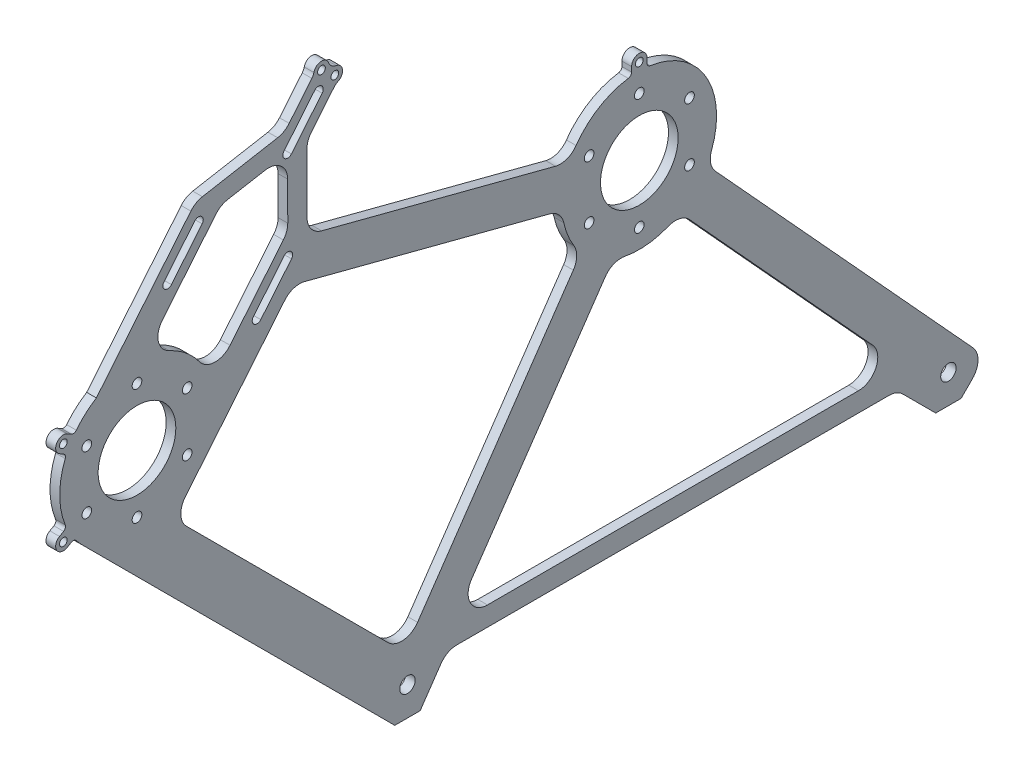
from build123d import *

# Parameters (mm, degrees)
SZKIC1_R                    = 2.5
SZKIC1_R_2                  = 4
SZKIC1_R_3                  = 2
SZKIC1_R_4                  = 20.1
DODANIE_WYCI_GNI_CIE1_DEPTH = 5


with BuildPart() as part:
    # Szkic1 → Dodanie-wyciągnięcie1 (new body)
    with BuildSketch(Plane(origin=(0, 0, 0), x_dir=(0, 0, -1), z_dir=(1, 0, 0))):
        with BuildLine():
            Line((-288.284271247, -28.284271247), (-126.568542495, -190))
            Line((-126.568542495, -190), (-113.431457505, -190))
            Line((-113.431457505, -190), (-102.696405924, -174.344716444))
            ThreePointArc((-102.696405924, -174.344716444), (-99.109973789, -171.152603898), (-94.449117406, -170))
            Line((-94.449117406, -170), (129.289321881, -170))
            ThreePointArc((129.289321881, -170), (133.116156205, -170.761204675), (136.360389693, -172.928932188))
            Line((136.360389693, -172.928932188), (153.431457505, -190))
            Line((153.431457505, -190), (166.568542495, -190))
            Line((166.568542495, -190), (172.387546571, -184.180995923))
            ThreePointArc((172.387546571, -184.180995923), (175.313976082, -177.333640604), (172.69676688, -170.362236116))
            Line((172.69676688, -170.362236116), (39.354768311, -24.519425181))
            ThreePointArc((39.354768311, -24.519425181), (36.912448001, -19.646930148), (37.388045144, -14.217386549))
            ThreePointArc((37.388045144, -14.217386549), (34.471063996, 20.29151909), (5.714285714, 39.589732744))
            ThreePointArc((5.714285714, 39.589732744), (4.488142108, 40.25991204), (4, 41.569219382))
            Line((4, 41.569219382), (4, 44))
            ThreePointArc((4, 44), (0, 48), (-4, 44))
            Line((-4, 44), (-4, 41.569219382))
            ThreePointArc((-4, 41.569219382), (-4.488142108, 40.25991204), (-5.714285714, 39.589732744))
            ThreePointArc((-5.714285714, 39.589732744), (-20.933019357, 34.085315029), (-32.725168605, 23.001376911))
            ThreePointArc((-32.725168605, 23.001376911), (-37.463043952, 19.36327714), (-43.429641732, 19.075277692))
            Line((-43.429641732, 19.075277692), (-164.484501116, 50.640937114))
            ThreePointArc((-164.484501116, 50.640937114), (-169.870082497, 54.197619293), (-171.961310445, 60.303455894))
            Line((-171.961310445, 60.303455894), (-172.004365765, 91.223607004))
            ThreePointArc((-172.004365765, 91.223607004), (-171.417448461, 94.613040026), (-169.716707821, 97.603058322))
            Line((-169.716707821, 97.603058322), (-157.907804878, 111.91046591))
            ThreePointArc((-157.907804878, 111.91046591), (-157.048974104, 112.729699644), (-156.021245372, 113.323423371))
            ThreePointArc((-156.021245372, 113.323423371), (-153.625331654, 117.475816061), (-156.934314069, 120.944735629))
            ThreePointArc((-156.934314069, 120.944735629), (-159.288806591, 122.019488985), (-160.790480249, 124.127498955))
            ThreePointArc((-160.790480249, 124.127498955), (-164.823865313, 126.718748175), (-168.446669732, 123.578994087))
            ThreePointArc((-168.446669732, 123.578994087), (-168.834765174, 122.457336324), (-169.47630342, 121.458755887))
            Line((-169.47630342, 121.458755887), (-181.241905694, 107.203810439))
            ThreePointArc((-181.241905694, 107.203810439), (-183.910862715, 104.93427107), (-187.198850713, 103.724611838))
            Line((-187.198850713, 103.724611838), (-226.153990373, 96.778622252))
            ThreePointArc((-226.153990373, 96.778622252), (-229.441978371, 95.568963021), (-232.110935392, 93.299423651))
            Line((-232.110935392, 93.299423651), (-281.037741396, 34.020779488))
            ThreePointArc((-281.037741396, 34.020779488), (-286.640103025, 29.83797766), (-291.428571429, 24.743582965))
            ThreePointArc((-291.428571429, 24.743582965), (-292.622035527, 24.016801101), (-294, 24.248711306))
            Line((-294, 24.248711306), (-296.105117767, 25.464101615))
            ThreePointArc((-296.105117767, 25.464101615), (-301.569219382, 24), (-300.105117767, 18.535898385))
            Line((-300.105117767, 18.535898385), (-298, 17.320508076))
            ThreePointArc((-298, 17.320508076), (-297.110177635, 16.243110939), (-297.142857143, 14.846149779))
            ThreePointArc((-297.142857143, 14.846149779), (-300, 0), (-297.142857143, -14.846149779))
            ThreePointArc((-297.142857143, -14.846149779), (-297.110177635, -16.243110939), (-298, -17.320508076))
            Line((-298, -17.320508076), (-300.105117767, -18.535898385))
            ThreePointArc((-300.105117767, -18.535898385), (-301.569219382, -24), (-296.105117767, -25.464101615))
            Line((-296.105117767, -25.464101615), (-294, -24.248711306))
            ThreePointArc((-294, -24.248711306), (-292.622035527, -24.016801101), (-291.428571429, -24.743582965))
            ThreePointArc((-291.428571429, -24.743582965), (-289.908861789, -26.560496729), (-288.284271247, -28.284271247))
        make_face()
        with Locations((-285.980762114, -15)):
            Circle(SZKIC1_R, mode=Mode.SUBTRACT)
        with Locations((-234.019237886, -15)):
            Circle(SZKIC1_R, mode=Mode.SUBTRACT)
        with Locations((-260, -30)):
            Circle(SZKIC1_R, mode=Mode.SUBTRACT)
        with Locations((-234.019237886, 15)):
            Circle(SZKIC1_R, mode=Mode.SUBTRACT)
        with Locations((-260, 30)):
            Circle(SZKIC1_R, mode=Mode.SUBTRACT)
        with Locations((-285.980762114, 15)):
            Circle(SZKIC1_R, mode=Mode.SUBTRACT)
        with Locations((-25.980762114, -15)):
            Circle(SZKIC1_R, mode=Mode.SUBTRACT)
        with Locations((0, 30)):
            Circle(SZKIC1_R, mode=Mode.SUBTRACT)
        with Locations((25.980762114, -15)):
            Circle(SZKIC1_R, mode=Mode.SUBTRACT)
        with Locations((-25.980762114, 15)):
            Circle(SZKIC1_R, mode=Mode.SUBTRACT)
        with Locations((0, -30)):
            Circle(SZKIC1_R, mode=Mode.SUBTRACT)
        with Locations((25.980762114, 15)):
            Circle(SZKIC1_R, mode=Mode.SUBTRACT)
        with Locations((160, -175)):
            Circle(SZKIC1_R_2, mode=Mode.SUBTRACT)
        with Locations((-120, -175)):
            Circle(SZKIC1_R_2, mode=Mode.SUBTRACT)
        with Locations((-157.596930712, 117)):
            Circle(SZKIC1_R_3, mode=Mode.SUBTRACT)
        with Locations((-298.105117767, 22)):
            Circle(SZKIC1_R_3, mode=Mode.SUBTRACT)
        with Locations((-298.105117767, -22)):
            Circle(SZKIC1_R_3, mode=Mode.SUBTRACT)
        with Locations((0, 44)):
            Circle(SZKIC1_R_3, mode=Mode.SUBTRACT)
        with Locations((-164.538029837, 122.728973986)):
            Circle(SZKIC1_R_3, mode=Mode.SUBTRACT)
        Circle(SZKIC1_R_4, mode=Mode.SUBTRACT)
        with Locations((-260, 0)):
            Circle(SZKIC1_R_4, mode=Mode.SUBTRACT)
        with BuildLine():
            Line((113.43104574, -160), (-78.606748373, -160))
            ThreePointArc((-78.606748373, -160), (-87.454144474, -154.660856383), (-86.854036891, -144.344716444))
            Line((-86.854036891, -144.344716444), (-17.668476451, -43.449107469))
            ThreePointArc((-17.668476451, -43.449107469), (-13.223838191, -39.855615376), (-7.536950346, -39.28351282))
            ThreePointArc((-7.536950346, -39.28351282), (3.864441422, -39.812888522), (14.951190435, -37.100699516))
            ThreePointArc((14.951190435, -37.100699516), (20.905737176, -36.624668147), (26.069276164, -39.628182399))
            Line((26.069276164, -39.628182399), (120.81133386, -143.252308005))
            ThreePointArc((120.81133386, -143.252308005), (122.581917828, -154.032559984), (113.43104574, -160))
        make_face(mode=Mode.SUBTRACT)
        with BuildLine():
            Line((-230.127631021, 87.847542068), (-246.041971216, 68.566076823))
            ThreePointArc((-246.041971216, 68.566076823), (-245.705269789, 65.04661207), (-242.185805036, 65.383313498))
            Line((-242.185805036, 65.383313498), (-226.271464841, 84.664778743))
            ThreePointArc((-226.271464841, 84.664778743), (-226.608166268, 88.184243496), (-230.127631021, 87.847542068))
        make_face(mode=Mode.SUBTRACT)
        with BuildLine():
            Line((-180.015328795, 45.851272047), (-195.92966899, 26.569806802))
            ThreePointArc((-195.92966899, 26.569806802), (-199.44913251, 26.233106867), (-199.78583517, 29.752570127))
            Line((-199.78583517, 29.752570127), (-183.871494975, 49.034035373))
            ThreePointArc((-183.871494975, 49.034035373), (-180.352030222, 49.3707368), (-180.015328795, 45.851272047))
        make_face(mode=Mode.SUBTRACT)
        with BuildLine():
            Line((-168.022669891, 115.365136739), (-183.937010086, 96.083671494))
            ThreePointArc((-183.937010086, 96.083671494), (-183.600307428, 92.564208231), (-180.080843905, 92.900908168))
            Line((-180.080843905, 92.900908168), (-164.16650371, 112.182373413))
            ThreePointArc((-164.16650371, 112.182373413), (-164.503205138, 115.701838166), (-168.022669891, 115.365136739))
        make_face(mode=Mode.SUBTRACT)
        with BuildLine():
            Line((-219.135917613, 85.455241508), (-246.893276278, 51.82503505))
            ThreePointArc((-246.893276278, 51.82503505), (-248.92741606, 43.222036437), (-243.344755134, 36.367606719))
            ThreePointArc((-243.344755134, 36.367606719), (-234.659585563, 30.949368267), (-227.634046499, 23.504149718))
            ThreePointArc((-227.634046499, 23.504149718), (-219.852138073, 19.384980283), (-211.830225762, 23.014660496))
            Line((-211.830225762, 23.014660496), (-184.252463803, 56.427271527))
            ThreePointArc((-184.252463803, 56.427271527), (-182.551723162, 59.417289823), (-181.964805859, 62.806722845))
            Line((-181.964805859, 62.806722845), (-181.992323332, 82.568379002))
            ThreePointArc((-181.992323332, 82.568379002), (-185.577134018, 90.225534472), (-193.747700979, 92.399179588))
            Line((-193.747700979, 92.399179588), (-213.178972594, 88.934440109))
            ThreePointArc((-213.178972594, 88.934440109), (-216.466960592, 87.724780877), (-219.135917613, 85.455241508))
        make_face(mode=Mode.SUBTRACT)
        with BuildLine():
            Line((-234.396368988, -46.816834448), (-130.09597348, -151.117229955))
            ThreePointArc((-130.09597348, -151.117229955), (-122.10458776, -154.003722836), (-114.77761715, -149.701445699))
            Line((-114.77761715, -149.701445699), (-34.163053488, -32.138540358))
            ThreePointArc((-34.163053488, -32.138540358), (-32.412639003, -26.697580533), (-33.928273605, -21.186605442))
            ThreePointArc((-33.928273605, -21.186605442), (-37.072718821, -15.020436718), (-39.107086988, -8.40450756))
            ThreePointArc((-39.107086988, -8.40450756), (-41.661077797, -3.589607011), (-46.360677759, -0.829191003))
            Line((-46.360677759, -0.829191003), (-173.3398304, 32.281257485))
            ThreePointArc((-173.3398304, 32.281257485), (-178.940732209, 32.119415159), (-183.575343737, 28.970340691))
            Line((-183.575343737, 28.970340691), (-235.037633537, -33.380239985))
            ThreePointArc((-235.037633537, -33.380239985), (-237.313932106, -40.222476336), (-234.396368988, -46.816834448))
        make_face(mode=Mode.SUBTRACT)
    extrude(amount=DODANIE_WYCI_GNI_CIE1_DEPTH)


solid = part.part
